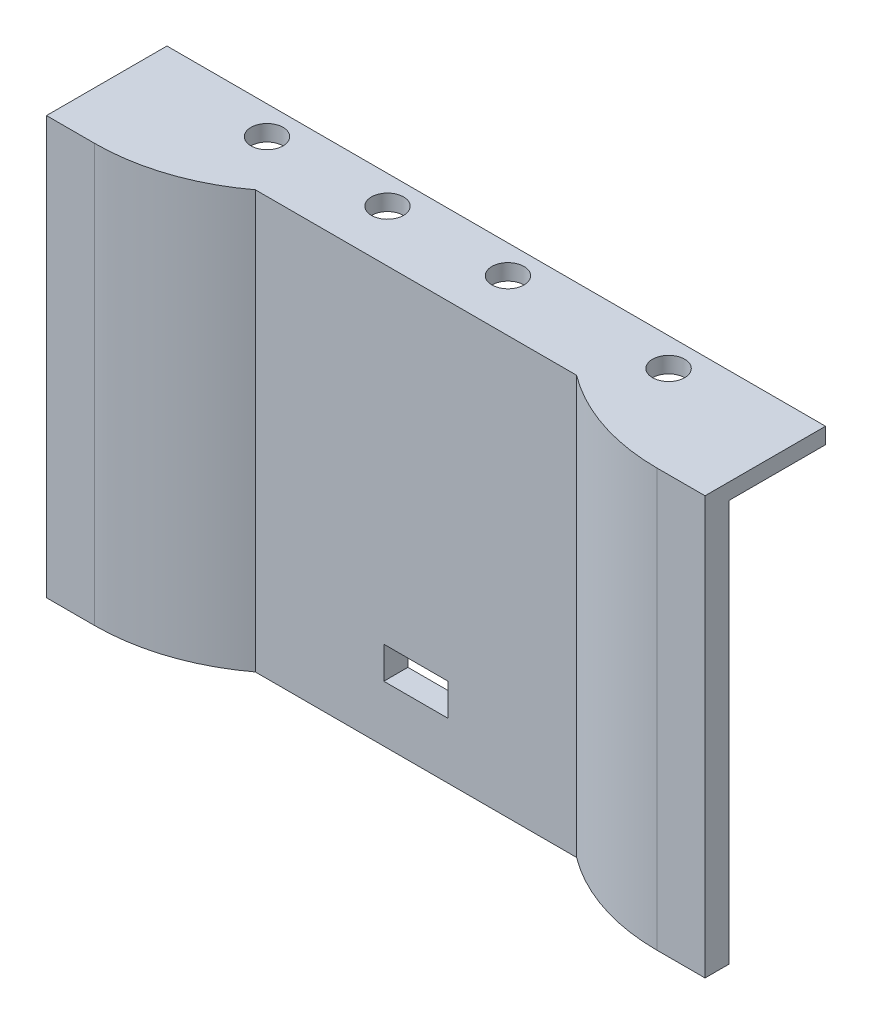
from build123d import *

# Parameters (mm, degrees)
BOSS_EXTRUDE1_DEPTH = 52
CUT_EXTRUDE1_DEPTH  = 52
CHAMFER2_SIZE       = 10
SKETCH3_W           = 8
SKETCH3_H           = 4
CUT_EXTRUDE2_DEPTH  = 52
FILLET1_R           = 25
SKETCH4_W           = 3
SKETCH4_H           = 5
CUT_EXTRUDE3_DEPTH  = 52
BOSS_EXTRUDE2_DEPTH = 2
SKETCH6_R           = 2
CUT_EXTRUDE4_DEPTH  = 21


with BuildPart() as part:
    # Sketch1 → Boss-Extrude1 (new body)
    with BuildSketch(Plane(origin=(0, 0, 0), x_dir=(1, 0, 0), z_dir=(0, 1, 0))):
        Polygon((-41, -7.5), (-30, -7.5), (-30, -2.5), (30, -2.5), (30, -7.5), (41, -7.5), (41, 7.5), (-41, 7.5), align=None)
    extrude(amount=BOSS_EXTRUDE1_DEPTH)

    # Sketch2 → Cut-Extrude1 (cut)
    with BuildSketch(Plane(origin=(0, 52, 0), x_dir=(1, 0, 0), z_dir=(0, 1, 0))):
        Polygon((-41, -4.5), (-33, -4.5), (-33, 0.5), (33, 0.5), (33, -4.5), (41, -4.5), (41, 7.5), (33, 7.5), (-33, 7.5), (-41, 7.5), align=None)
    extrude(amount=-CUT_EXTRUDE1_DEPTH, mode=Mode.SUBTRACT)

    # Chamfer2
    # the kernel refuses this chamfer: 10 mm, written as the material it adds along each edge
    with BuildSketch(Plane(origin=(30, 0, 2.5), x_dir=(-0.9996219169112968, 0, -0.02749587661058636), z_dir=(0, 1, 0))) as chamfer2_piece_1_section:
        Polygon((CHAMFER2_SIZE * 0.999621916911, CHAMFER2_SIZE * 0.0274958766106), (-CHAMFER2_SIZE * 0.0274958766106, CHAMFER2_SIZE * 0.999621916911), (0, 0), align=None)
    chamfer2_piece_1 = extrude(amount=52, mode=Mode.PRIVATE)
    chamfer2_piece_1 = split(chamfer2_piece_1, bisect_by=Plane(origin=(26.065989159, 26, 7.5), z_dir=(0, 0, -1)), keep=Keep.TOP, mode=Mode.PRIVATE)
    add(chamfer2_piece_1)
    with BuildSketch(Plane(origin=(-30, 0, 2.5), x_dir=(-0.027495876610586317, 0, 0.9996219169112968), z_dir=(0, 1, 0))) as chamfer2_piece_2_section:
        Polygon((CHAMFER2_SIZE * 0.999621916911, CHAMFER2_SIZE * 0.0274958766106), (-CHAMFER2_SIZE * 0.0274958766106, CHAMFER2_SIZE * 0.999621916911), (0, 0), align=None)
    chamfer2_piece_2 = extrude(amount=52, mode=Mode.PRIVATE)
    chamfer2_piece_2 = split(chamfer2_piece_2, bisect_by=Plane(origin=(-26.065989159, 26, 7.5), z_dir=(0, 0, -1)), keep=Keep.TOP, mode=Mode.PRIVATE)
    add(chamfer2_piece_2)

    # Sketch3 → Cut-Extrude2 (cut)
    with BuildSketch(Plane.XY.offset(2.5)):
        with Locations((0, 9)):
            Rectangle(SKETCH3_W, SKETCH3_H)
    extrude(amount=-CUT_EXTRUDE2_DEPTH, mode=Mode.SUBTRACT)

    # Fillet1
    # the kernel refuses this fillet: 25 mm, written as the material it takes off along each edge
    with BuildSketch(Plane(origin=(25, -25, 7.5), x_dir=(-0.7071067811862641, 0, -0.7071067811868309), z_dir=(0, 1, 0)), Plane(origin=(-25, 77, 7.5), x_dir=(0.7071067811868301, 0, -0.7071067811862649), z_dir=(0, -1, 0))) as fillet1_piece_1:
        with BuildLine():
            CenterArc((10.606601718, -24.748737342), FILLET1_R, 98.130102354, 36.869897646)
            Line((-7.071067812, -7.071067812), (-7.424621202, -6.717514421))
            Line((-7.424621202, -6.717514421), (-0.353553391, 0.353553391))
            Line((-0.353553391, 0.353553391), (0, 0.5))
            ThreePointArc((0, 0.5), (3.535533906, 0.5), (7.000357134, 0.494974747))
            Line((7.000357134, 0.494974747), (7.071067812, 0))
        make_face()
    extrude(amount=102, mode=Mode.SUBTRACT)

    # Sketch4 → Cut-Extrude3 (cut)
    with BuildSketch(Plane(origin=(0, 52, 0), x_dir=(1, 0, 0), z_dir=(0, 1, 0))):
        with Locations((-31.5, -2)):
            Rectangle(SKETCH4_W, SKETCH4_H)
        with Locations((31.5, -2)):
            Rectangle(SKETCH4_W, SKETCH4_H)
    extrude(amount=-CUT_EXTRUDE3_DEPTH, mode=Mode.SUBTRACT)

    # Sketch5 → Boss-Extrude2 (add)
    with BuildSketch(Plane(origin=(0, 52, 0), x_dir=(1, 0, 0), z_dir=(0, 1, 0))):
        Polygon((-30, 0.5), (30, 0.5), (30, -4.5), (41, -4.5), (41, 7.5), (30, 7.5), (-30, 7.5), (-41, 7.5), (-41, -4.5), (-30, -4.5), align=None)
    extrude(amount=-BOSS_EXTRUDE2_DEPTH)

    # Sketch6 → Cut-Extrude4 (cut)
    with BuildSketch(Plane(origin=(0, 52, 0), x_dir=(1, 0, 0), z_dir=(0, 1, 0))):
        with Locations(Location((-25, 3.96, 0), (0, 0, 270))):
            Circle(SKETCH6_R)
        with Locations(Location((-10, 3.96, 0), (0, 0, 270))):
            Circle(SKETCH6_R)
        with Locations(Location((5, 3.96, 0), (0, 0, 270))):
            Circle(SKETCH6_R)
        with Locations(Location((25, 3.96, 0), (0, 0, 270))):
            Circle(SKETCH6_R)
    extrude(amount=-CUT_EXTRUDE4_DEPTH, mode=Mode.SUBTRACT)


solid = part.part
